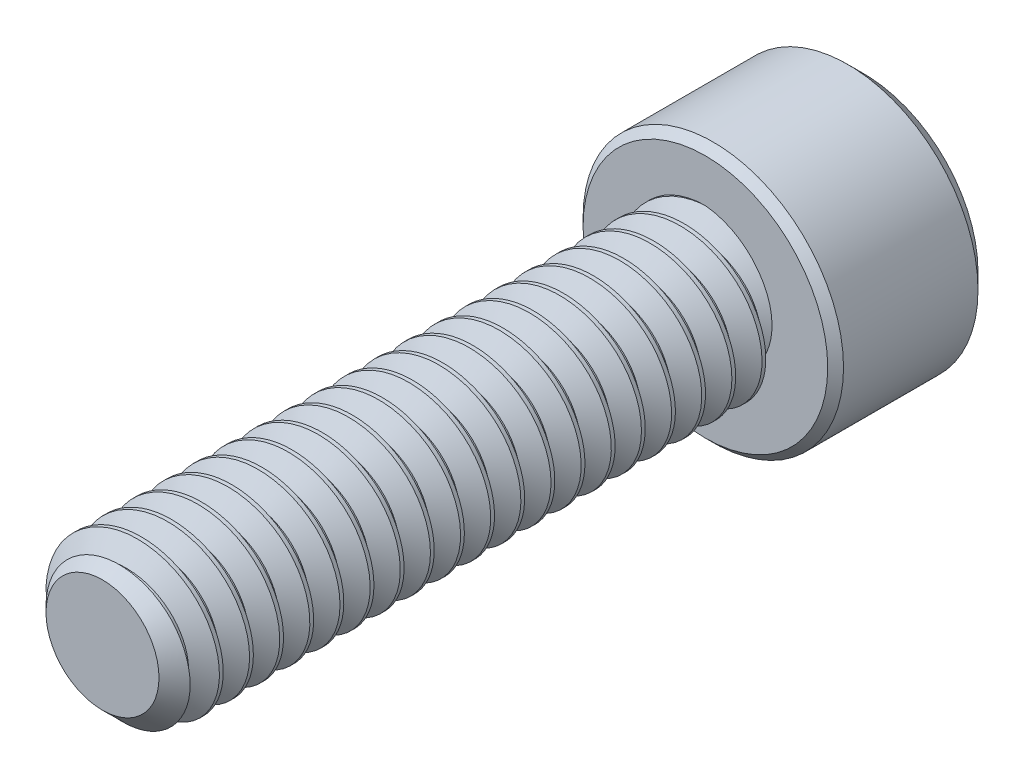
from build123d import *

# Parameters (mm, degrees)
SKETCH1_R          = 2.0828
EXTRUDE1_DEPTH     = 15.875
CHAMFER3_SIZE      = 0.5953125
CUT_SWEEP1_PITCH   = 0.79375
SKETCH6_R          = 3.429
EXTRUDE2_DEPTH     = 4.1656
CUT_EXTRUDE1_DEPTH = 2.67890625
SKETCH8_R          = 2.062222993
CUT_EXTRUDE2_DEPTH = 0.41656
CUT_EXTRUDE2_DRAFT = -45
CHAMFER1_SIZE      = 0.41656
CHAMFER2_SIZE      = 0.20828


with BuildPart() as part:
    # Sketch1 → Extrude1 (new body)
    with BuildSketch(Plane.XY):
        Circle(SKETCH1_R)
    extrude(amount=-EXTRUDE1_DEPTH)

    # Chamfer3
    chamfer3_edges = [part.edges().sort_by_distance(p)[0] for p in [
        (-2.0828, 0, 0),
    ]]
    chamfer(chamfer3_edges, length=CHAMFER3_SIZE)

    # Cut-Sweep1: the profile of Sketch3 profile screwed along a right-hand helix of 21 turns, 6 arcs to a turn; built about Z, then put on its axis
    cut_sweep1_z = Axis((0, 0, 0), (0, 0, 1))
    cut_sweep1_corners = [(2.0831, 0, -0.694704455), (1.567244252, 0, -0.396875), (1.567244252, 0, -0.29765625), (2.0831, 0, 0.000173205)]
    with BuildLine(mode=Mode.PRIVATE) as cut_sweep1_profile:
        Line(cut_sweep1_corners[0], cut_sweep1_corners[1])
        Line(cut_sweep1_corners[1], cut_sweep1_corners[2])
        Line(cut_sweep1_corners[2], cut_sweep1_corners[3])
        Line(cut_sweep1_corners[3], cut_sweep1_corners[0])
    cut_sweep1_cap = Face(cut_sweep1_profile.wire())
    cut_sweep1_turn_angles = [0, 30, 60, 90, 120, 150, 180, 210, 240, 270, 300, 330, 360]
    cut_sweep1_turn_weights = [1, 0.8660254037844387, 1, 0.8660254037844387, 1, 0.8660254037844387, 1, 0.8660254037844387, 1, 0.8660254037844387, 1, 0.8660254037844387, 1]
    cut_sweep1_turn_rails = [Edge.make_bspline([Vector(p[0], p[1], 0).rotate(cut_sweep1_z, cut_sweep1_turn_angles[k]) / cut_sweep1_turn_weights[k] + Vector(0, 0, p[2] + CUT_SWEEP1_PITCH * cut_sweep1_turn_angles[k] / 360) for k in range(13)], [0, 0, 0, 1, 1, 2, 2, 3, 3, 4, 4, 5, 5, 6, 6, 6], 2, cut_sweep1_turn_weights) for p in cut_sweep1_corners]
    cut_sweep1_turn_sides = [Face.make_surface_from_curves(cut_sweep1_turn_rails[p[0]], cut_sweep1_turn_rails[p[1]]) for p in [(0, 1), (1, 2), (2, 3), (3, 0)]]
    cut_sweep1 = Plane(origin=(0, 0, 0), x_dir=(0, 1, 0), z_dir=(0, 0, -1)) * Solid(Shell([*[p.moved(Location((0, 0, CUT_SWEEP1_PITCH * i))) for i in range(21) for p in cut_sweep1_turn_sides], cut_sweep1_cap, cut_sweep1_cap.rotate(cut_sweep1_z, 7560).moved(Location((0, 0, CUT_SWEEP1_PITCH * 7560 / 360)))]))
    add(cut_sweep1, mode=Mode.SUBTRACT)

    # Sketch6 → Extrude2 (add)
    with BuildSketch(Plane(origin=(0, 0, -15.875), x_dir=(-1, 0, 0), z_dir=(0, 0, -1))):
        Circle(SKETCH6_R)
    extrude(amount=EXTRUDE2_DEPTH)

    # Sketch7 → Cut-Extrude1 (cut)
    with BuildSketch(Plane(origin=(0, 0, -20.0406), x_dir=(-1, 0, 0), z_dir=(0, 0, -1))):
        Polygon((0, 2.062222993), (-1.7859375, 1.031111496), (-1.7859375, -1.031111496), (0, -2.062222993), (1.7859375, -1.031111496), (1.7859375, 1.031111496), align=None)
    extrude(amount=-CUT_EXTRUDE1_DEPTH, mode=Mode.SUBTRACT)


with BuildPart() as cut_extrude2_tool:
    # Sketch8 → Cut-Extrude2 (with draft: the straight prism first)
    with BuildSketch(Plane(origin=(0, 0, -20.0406), x_dir=(-1, 0, 0), z_dir=(0, 0, -1))):
        Circle(SKETCH8_R)
    extrude(amount=-CUT_EXTRUDE2_DEPTH)
    # Cut-Extrude2: the draft: its side faces are tilted about the plane it starts from
    cut_extrude2_sides = [cut_extrude2_tool.faces().sort_by_distance(p)[0] for p in [
        (2.062222993, 0, -19.83232),
    ]]
    draft(cut_extrude2_sides, Plane(origin=(0, 0, -20.0406), x_dir=(-1, 0, 0), z_dir=(0, 0, -1)), CUT_EXTRUDE2_DRAFT)


with BuildPart() as part_1:
    add(part.part)

    # Cut-Extrude2: cut by cut_extrude2_tool
    add(cut_extrude2_tool.part, mode=Mode.SUBTRACT)

    # Chamfer1
    chamfer1_edges = [part_1.edges().sort_by_distance(p)[0] for p in [
        (3.429, 0, -20.0406),
    ]]
    chamfer(chamfer1_edges, length=CHAMFER1_SIZE)

    # Chamfer2
    chamfer2_edges = [part_1.edges().sort_by_distance(p)[0] for p in [
        (3.429, 0, -15.875),
    ]]
    chamfer(chamfer2_edges, length=CHAMFER2_SIZE)


solid = part_1.part
